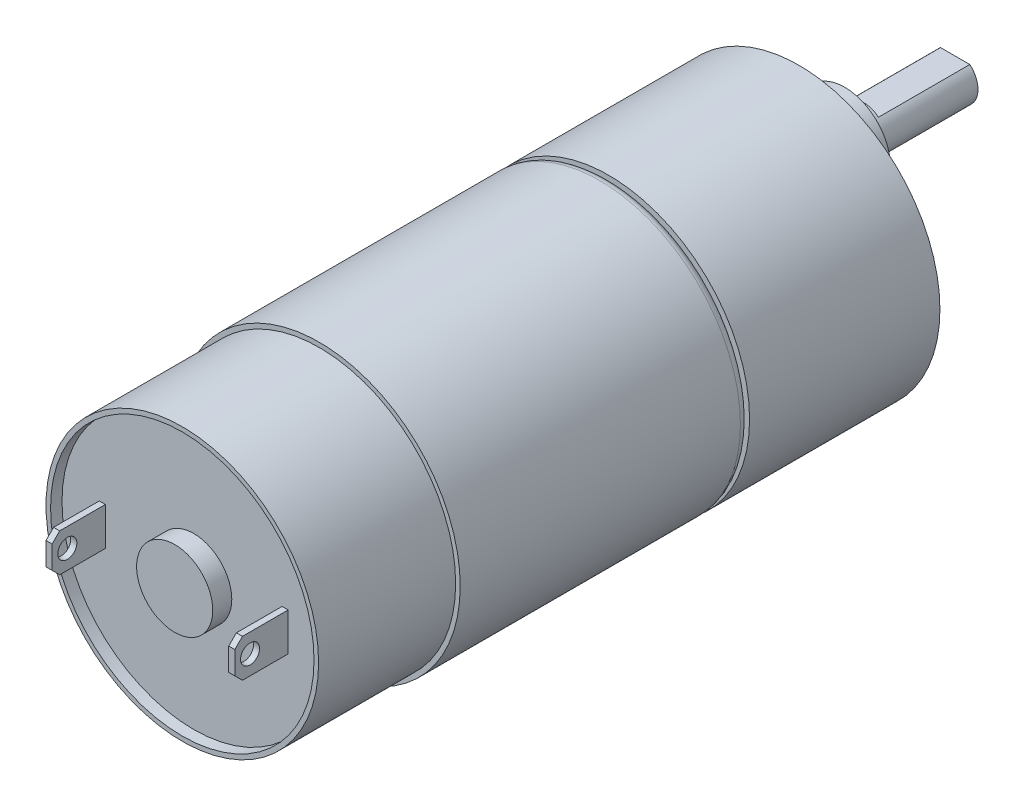
from build123d import *

# Parameters (mm, degrees)
SKETCH1_R           = 18.5
BOSS_EXTRUDE1_DEPTH = 25
SKETCH2_R           = 18.5
BOSS_EXTRUDE2_DEPTH = 56
FILLET1_R           = 1.2
CUT_EXTRUDE2_START  = -18
SKETCH3_R           = 18.5
SKETCH3_R_2         = 17.9
CUT_EXTRUDE2_DEPTH  = 18
SKETCH4_R           = 17.3
CUT_EXTRUDE3_DEPTH  = 1.5
SKETCH5_R           = 5
BOSS_EXTRUDE3_DEPTH = 2.5
SKETCH6_W           = 0.8
SKETCH6_H           = 5
BOSS_EXTRUDE4_DEPTH = 7
CUT_EXTRUDE4_REACH  = 95.698
SKETCH7_R           = 1.25
CHAMFER1_SIZE       = 1
SKETCH8_R           = 6
BOSS_EXTRUDE5_DEPTH = 6
SKETCH9_R           = 3
BOSS_EXTRUDE6_DEPTH = 2.5
BOSS_EXTRUDE7_DEPTH = 12
CUT_EXTRUDE5_DEPTH  = 0.6
FILLET2_R           = 0.2
SKETCH12_R          = 1.5
CUT_EXTRUDE6_DEPTH  = 4


with BuildPart() as part:
    # Sketch1 → Boss-Extrude1 (new body)
    with BuildSketch(Plane.XY):
        Circle(SKETCH1_R)
    extrude(amount=BOSS_EXTRUDE1_DEPTH)

    # Sketch8 → Boss-Extrude5 (add)
    with BuildSketch(Plane(origin=(0, 0, 0), x_dir=(-1, 0, 0), z_dir=(0, 0, -1))):
        with Locations(Location((0, 7, 0), (0, 0, 180))):
            Circle(SKETCH8_R)
    extrude(amount=BOSS_EXTRUDE5_DEPTH)

    # Sketch9 → Boss-Extrude6 (add)
    with BuildSketch(Plane(origin=(0, 0, -6), x_dir=(-1, 0, 0), z_dir=(0, 0, -1))):
        with Locations((0, 7)):
            Circle(SKETCH9_R)
    extrude(amount=BOSS_EXTRUDE6_DEPTH)

    # Sketch10 → Boss-Extrude7 (add)
    with BuildSketch(Plane(origin=(0, 0, -8.5), x_dir=(-1, 0, 0), z_dir=(0, 0, -1))):
        with BuildLine():
            ThreePointArc((3, 7), (2.718309041, 8.269171366), (1.926136028, 9.3))
            Line((1.926136028, 9.3), (-1.926136028, 9.3))
            ThreePointArc((-1.926136028, 9.3), (-1.269171366, 4.281690959), (3, 7))
        make_face()
    extrude(amount=BOSS_EXTRUDE7_DEPTH)

    # Sketch11 → Cut-Extrude5 (cut)
    with BuildSketch(Plane(origin=(0, 0, 0), x_dir=(-1, 0, 0), z_dir=(0, 0, -1))):
        with BuildLine():
            ThreePointArc((-7.379452132, 10.089285714), (0, -12.5), (7.379452132, 10.089285714))
            ThreePointArc((7.379452132, 10.089285714), (0, -1), (-7.379452132, 10.089285714))
        make_face()
    extrude(amount=-CUT_EXTRUDE5_DEPTH, mode=Mode.SUBTRACT)

    # Fillet2
    fillet2_edges = [part.edges().sort_by_distance(p)[0] for p in [
        (0, -12.5, 0),
        (0, -1, 0),
        (0, -12.5, 0.6),
        (0, -1, 0.6),
    ]]
    fillet(fillet2_edges, radius=FILLET2_R)

    # Sketch12 → Cut-Extrude6 (cut)
    with BuildSketch(Plane(origin=(0, 0, 0), x_dir=(-1, 0, 0), z_dir=(0, 0, -1))):
        with Locations((-15.5, 0)):
            Circle(SKETCH12_R)
        with Locations((-7.75, 13.423393759)):
            Circle(SKETCH12_R)
        with Locations((7.75, 13.423393759)):
            Circle(SKETCH12_R)
        with Locations((15.5, 0)):
            Circle(SKETCH12_R)
        with Locations((7.75, -13.423393759)):
            Circle(SKETCH12_R)
        with Locations((-7.75, -13.423393759)):
            Circle(SKETCH12_R)
    extrude(amount=-CUT_EXTRUDE6_DEPTH, mode=Mode.SUBTRACT)


with BuildPart() as body_2:
    # Sketch2 → Boss-Extrude2 (new body)
    with BuildSketch(Plane.XY.offset(25)):
        Circle(SKETCH2_R)
    extrude(amount=BOSS_EXTRUDE2_DEPTH)

    # Fillet1
    fillet1_edges = [body_2.edges().sort_by_distance(p)[0] for p in [
        (-18.5, 0, 25),
    ]]
    fillet(fillet1_edges, radius=FILLET1_R)

    # Sketch3 → Cut-Extrude2 (cut)
    with BuildSketch(Plane.XY.offset(81).offset(CUT_EXTRUDE2_START)):
        Circle(SKETCH3_R)
        Circle(SKETCH3_R_2, mode=Mode.SUBTRACT)
    extrude(amount=CUT_EXTRUDE2_DEPTH, mode=Mode.SUBTRACT)

    # Sketch4 → Cut-Extrude3 (cut)
    with BuildSketch(Plane.XY.offset(81)):
        Circle(SKETCH4_R)
    extrude(amount=-CUT_EXTRUDE3_DEPTH, mode=Mode.SUBTRACT)

    # Sketch5 → Boss-Extrude3 (add)
    with BuildSketch(Plane.XY.offset(79.5)):
        Circle(SKETCH5_R)
    extrude(amount=BOSS_EXTRUDE3_DEPTH)

    # Sketch6 → Boss-Extrude4 (add)
    with BuildSketch(Plane.XY.offset(79.5)):
        with Locations((-12, 0)):
            Rectangle(SKETCH6_W, SKETCH6_H)
        with Locations((12, 0)):
            Rectangle(SKETCH6_W, SKETCH6_H)
    extrude(amount=BOSS_EXTRUDE4_DEPTH)

    # Cut-Extrude4: up to this face of the body (flat: up to its plane)
    cut_extrude4_end = Plane(body_2.part.faces().sort_by_distance((12.4, 0, 83))[0])
    # Sketch7 → Cut-Extrude4 (cut, up to the picked face)
    with BuildSketch(Plane.ZY.offset(12.4), mode=Mode.PRIVATE) as cut_extrude4_sk1:
        with Locations((84.5, 0)):
            Circle(SKETCH7_R)
    cut_extrude4_tool1 = split(extrude(cut_extrude4_sk1.sketch, amount=-CUT_EXTRUDE4_REACH, mode=Mode.PRIVATE), bisect_by=cut_extrude4_end, keep=Keep.BOTH, mode=Mode.PRIVATE)
    add(cut_extrude4_tool1.solids().sort_by(Axis((-12.4, 0, 84.5), (1, 0, 0)))[0], mode=Mode.SUBTRACT)

    # Chamfer1
    chamfer1_edges = [body_2.edges().sort_by_distance(p)[0] for p in [
        (-12, 2.5, 86.5),
        (-12, -2.5, 86.5),
        (12, 2.5, 86.5),
        (12, -2.5, 86.5),
    ]]
    chamfer(chamfer1_edges, length=CHAMFER1_SIZE)


solid = Compound([part.part, body_2.part])
